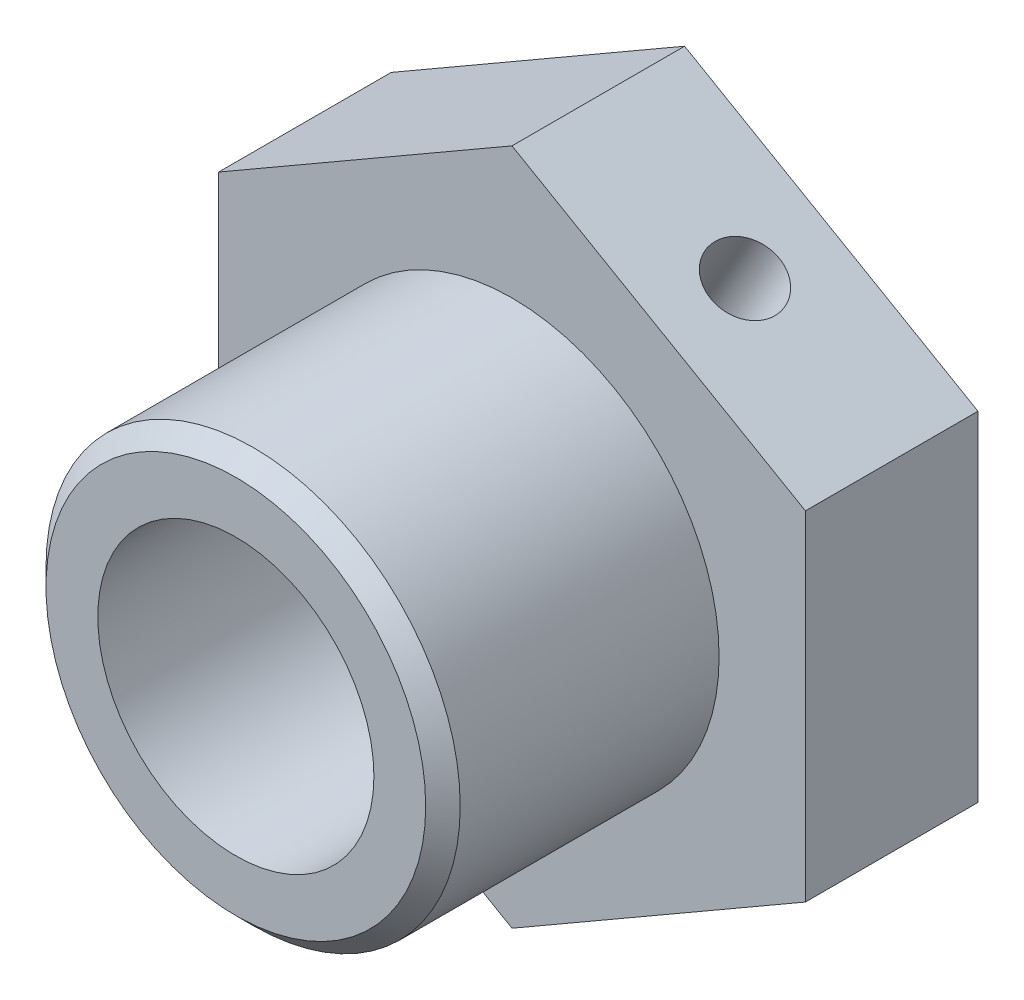
from build123d import *

# Parameters (mm, degrees)
SALIENTE_EXTRUIR1_DEPTH = 5
CROQUIS2_R              = 6
SALIENTE_EXTRUIR2_DEPTH = 8
CROQUIS3_R              = 4
CORTAR_EXTRUIR1_DEPTH   = 19.373440977
CHAFL_N1_SIZE           = 0.5
CROQUIS4_R              = 1
CORTAR_EXTRUIR2_DEPTH   = 26.031646636


with BuildPart() as part:
    # Croquis1 → Saliente-Extruir1 (new body)
    with BuildSketch(Plane.XY):
        Polygon((0, 9.814954576), (-8.5, 4.907477288), (-8.5, -4.907477288), (0, -9.814954576), (8.5, -4.907477288), (8.5, 4.907477288), align=None)
    extrude(amount=SALIENTE_EXTRUIR1_DEPTH)

    # Croquis2 → Saliente-Extruir2 (add)
    with BuildSketch(Plane.XY.offset(5)):
        Circle(CROQUIS2_R)
    extrude(amount=SALIENTE_EXTRUIR2_DEPTH)

    # Croquis3 → Cortar-Extruir1 (cut, through all)
    with BuildSketch(Plane.XY.offset(13)):
        Circle(CROQUIS3_R)
    extrude(amount=-CORTAR_EXTRUIR1_DEPTH, mode=Mode.SUBTRACT)

    # Chaflán1
    chafl_n1_edges = [part.edges().sort_by_distance(p)[0] for p in [
        (-6, 0, 13),
    ]]
    chamfer(chafl_n1_edges, length=CHAFL_N1_SIZE)

    # Croquis4 → Cortar-Extruir2 (cut, through all)
    with BuildSketch(Plane(origin=(4.25, 7.361215932, 0), x_dir=(0.8660254037844415, -0.4999999999999951, 0), z_dir=(0.49999999999999517, 0.8660254037844416, 0))):
        with Locations((0, -2.5)):
            Circle(CROQUIS4_R)
    extrude(amount=-CORTAR_EXTRUIR2_DEPTH, mode=Mode.SUBTRACT)


solid = part.part
